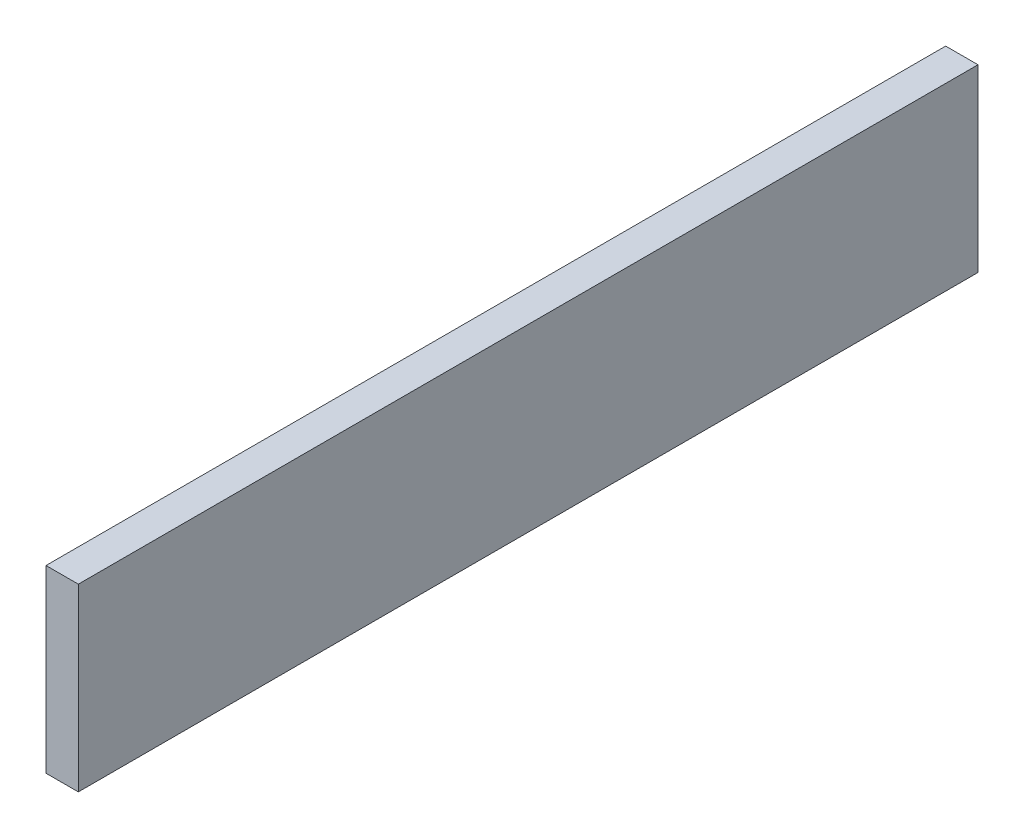
from build123d import *

# Parameters (mm, degrees)
SKETCH2_W           = 18.25625
SKETCH2_H           = 101.6
BOSS_EXTRUDE1_DEPTH = 508


with BuildPart() as part:
    # Sketch2 → Boss-Extrude1 (new body)
    with BuildSketch(Plane.XY):
        with Locations((9.128125, 50.8)):
            Rectangle(SKETCH2_W, SKETCH2_H)
    extrude(amount=BOSS_EXTRUDE1_DEPTH)


solid = part.part
